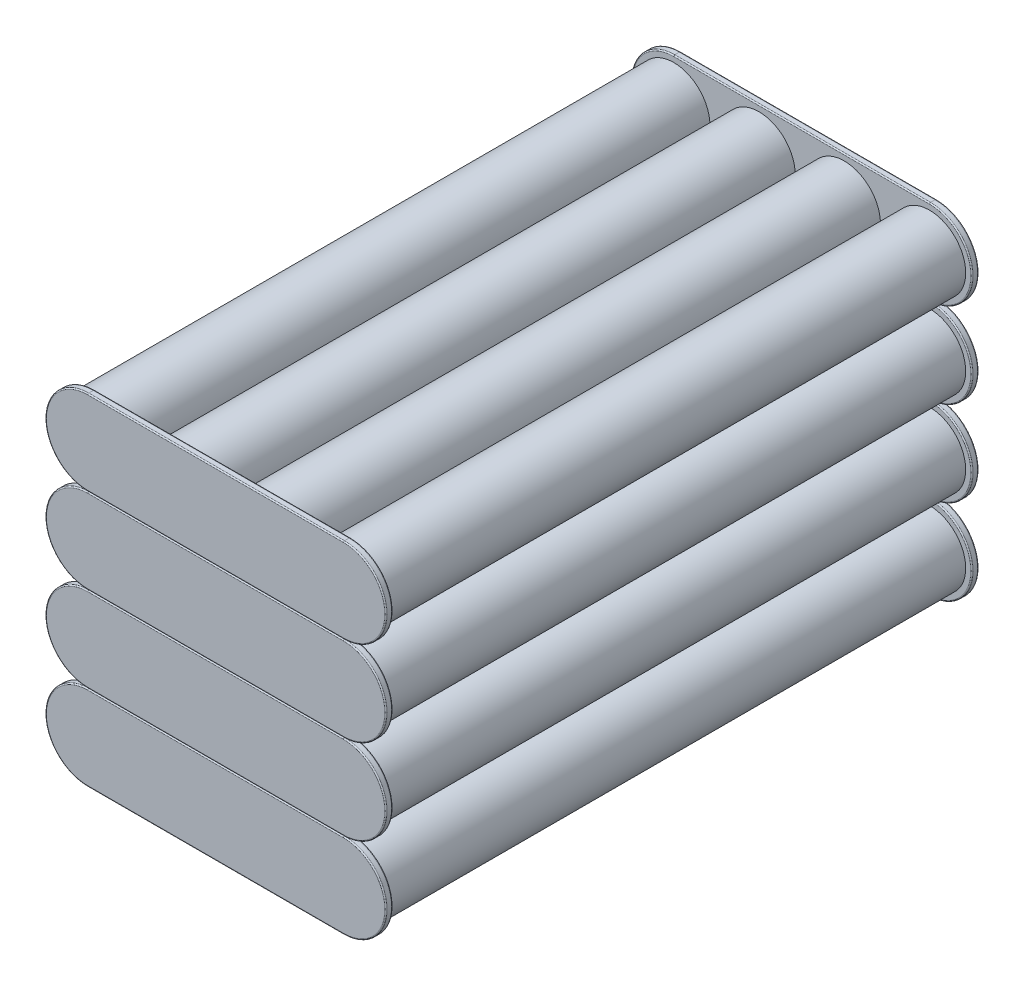
from build123d import *

# Parameters (mm, degrees)
SKETCH1_R              = 80.692435
BOSS_EXTRUDE1_DEPTH    = 1291.07896
BOSS_EXTRUDE1_2_DEPTH  = 1291.07896
BOSS_EXTRUDE1_3_DEPTH  = 1291.07896
BOSS_EXTRUDE1_4_DEPTH  = 1291.07896
BOSS_EXTRUDE1_5_DEPTH  = 1291.07896
BOSS_EXTRUDE1_6_DEPTH  = 1291.07896
BOSS_EXTRUDE1_7_DEPTH  = 1291.07896
BOSS_EXTRUDE1_8_DEPTH  = 1291.07896
BOSS_EXTRUDE1_9_DEPTH  = 1291.07896
BOSS_EXTRUDE1_10_DEPTH = 1291.07896
BOSS_EXTRUDE1_11_DEPTH = 1291.07896
BOSS_EXTRUDE1_12_DEPTH = 1291.07896
BOSS_EXTRUDE1_13_DEPTH = 1291.07896
BOSS_EXTRUDE1_14_DEPTH = 1291.07896
BOSS_EXTRUDE1_15_DEPTH = 1291.07896
BOSS_EXTRUDE1_16_DEPTH = 1291.07896
BOSS_EXTRUDE4_DEPTH    = 15
FILLET2_R              = 2.5
LPATTERN1_COUNT        = 4
LPATTERN1_PITCH        = 190
FILLET3_R              = 2.5
FILLET4_R              = 2.5
FILLET5_R              = 2.5
BOSS_EXTRUDE5_DEPTH    = 15
LPATTERN2_COUNT        = 4
LPATTERN2_PITCH        = 190
FILLET6_R              = 2.5
FILLET7_R              = 2.5
FILLET8_R              = 2.5
FILLET9_R              = 2.5


with BuildPart() as part:
    # Sketch1 → Boss-Extrude1 (new body)
    with BuildSketch(Plane.XY):
        with Locations((101.463857573, 0)):
            Circle(SKETCH1_R)
    extrude(amount=BOSS_EXTRUDE1_DEPTH)



with BuildPart() as body_2:
    # Sketch1 → Boss-Extrude1 2 (new body)
    with BuildSketch(Plane.XY):
        with Locations((291.463857573, 0)):
            Circle(SKETCH1_R)
    extrude(amount=BOSS_EXTRUDE1_2_DEPTH)


with BuildPart() as body_3:
    # Sketch1 → Boss-Extrude1 3 (new body)
    with BuildSketch(Plane.XY):
        with Locations((481.463857573, 0)):
            Circle(SKETCH1_R)
    extrude(amount=BOSS_EXTRUDE1_3_DEPTH)


with BuildPart() as body_4:
    # Sketch1 → Boss-Extrude1 4 (new body)
    with BuildSketch(Plane.XY):
        with Locations((671.463857573, 0)):
            Circle(SKETCH1_R)
    extrude(amount=BOSS_EXTRUDE1_4_DEPTH)


with BuildPart() as body_5:
    # Sketch1 → Boss-Extrude1 5 (new body)
    with BuildSketch(Plane.XY):
        with Locations((291.463857573, 190)):
            Circle(SKETCH1_R)
    extrude(amount=BOSS_EXTRUDE1_5_DEPTH)


with BuildPart() as body_6:
    # Sketch1 → Boss-Extrude1 6 (new body)
    with BuildSketch(Plane.XY):
        with Locations((481.463857573, 190)):
            Circle(SKETCH1_R)
    extrude(amount=BOSS_EXTRUDE1_6_DEPTH)


with BuildPart() as body_7:
    # Sketch1 → Boss-Extrude1 7 (new body)
    with BuildSketch(Plane.XY):
        with Locations((671.463857573, 190)):
            Circle(SKETCH1_R)
    extrude(amount=BOSS_EXTRUDE1_7_DEPTH)


with BuildPart() as body_8:
    # Sketch1 → Boss-Extrude1 8 (new body)
    with BuildSketch(Plane.XY):
        with Locations((291.463857573, 380)):
            Circle(SKETCH1_R)
    extrude(amount=BOSS_EXTRUDE1_8_DEPTH)


with BuildPart() as body_9:
    # Sketch1 → Boss-Extrude1 9 (new body)
    with BuildSketch(Plane.XY):
        with Locations((481.463857573, 380)):
            Circle(SKETCH1_R)
    extrude(amount=BOSS_EXTRUDE1_9_DEPTH)


with BuildPart() as body_10:
    # Sketch1 → Boss-Extrude1 10 (new body)
    with BuildSketch(Plane.XY):
        with Locations((671.463857573, 380)):
            Circle(SKETCH1_R)
    extrude(amount=BOSS_EXTRUDE1_10_DEPTH)


with BuildPart() as body_11:
    # Sketch1 → Boss-Extrude1 11 (new body)
    with BuildSketch(Plane.XY):
        with Locations((291.463857573, 570)):
            Circle(SKETCH1_R)
    extrude(amount=BOSS_EXTRUDE1_11_DEPTH)


with BuildPart() as body_12:
    # Sketch1 → Boss-Extrude1 12 (new body)
    with BuildSketch(Plane.XY):
        with Locations((481.463857573, 570)):
            Circle(SKETCH1_R)
    extrude(amount=BOSS_EXTRUDE1_12_DEPTH)


with BuildPart() as body_13:
    # Sketch1 → Boss-Extrude1 13 (new body)
    with BuildSketch(Plane.XY):
        with Locations((671.463857573, 570)):
            Circle(SKETCH1_R)
    extrude(amount=BOSS_EXTRUDE1_13_DEPTH)


with BuildPart() as body_14:
    # Sketch1 → Boss-Extrude1 14 (new body)
    with BuildSketch(Plane.XY):
        with Locations((101.463857573, 190)):
            Circle(SKETCH1_R)
    extrude(amount=BOSS_EXTRUDE1_14_DEPTH)


with BuildPart() as body_15:
    # Sketch1 → Boss-Extrude1 15 (new body)
    with BuildSketch(Plane.XY):
        with Locations((101.463857573, 380)):
            Circle(SKETCH1_R)
    extrude(amount=BOSS_EXTRUDE1_15_DEPTH)


with BuildPart() as body_16:
    # Sketch1 → Boss-Extrude1 16 (new body)
    with BuildSketch(Plane.XY):
        with Locations((101.463857573, 570)):
            Circle(SKETCH1_R)
    extrude(amount=BOSS_EXTRUDE1_16_DEPTH)


with BuildPart() as part_1:
    add(part.part)

    add(body_2.part)  # Boss-Extrude4 merges body 2

    add(body_3.part)  # Boss-Extrude4 merges body 3

    add(body_4.part)  # Boss-Extrude4 merges body 4
    # Sketch3 → Boss-Extrude4 (add)
    with BuildSketch(Plane.XY):
        with BuildLine():
            Line((101.463857573, 94.56136802), (671.463857573, 94.56136802))
            ThreePointArc((671.463857573, 94.56136802), (766.025225593, 0), (671.463857573, -94.56136802))
            Line((671.463857573, -94.56136802), (101.463857573, -94.56136802))
            ThreePointArc((101.463857573, -94.56136802), (6.902489553, 0), (101.463857573, 94.56136802))
        make_face()
    boss_extrude4 = extrude(amount=-BOSS_EXTRUDE4_DEPTH)

    # Fillet2
    fillet2_edges = [part_1.edges().sort_by_distance(p)[0] for p in [
        (386.463857573, -94.56136802, 0),
        (386.463857573, -94.56136802, -15),
        (766.025225593, 0, 0),
        (766.025225593, 0, -15),
        (6.902489553, 0, 0),
        (6.902489553, 0, -15),
        (386.463857573, 94.56136802, 0),
        (386.463857573, 94.56136802, -15),
    ]]
    fillet(fillet2_edges, radius=FILLET2_R)

    # Sketch7 → Boss-Extrude5 (add)
    with BuildSketch(Plane.XY.offset(1291.07896)):
        with BuildLine():
            Line((671.463857573, -94.56137), (101.463857573, -94.56137))
            ThreePointArc((101.463857573, -94.56137), (6.902487573, 0), (101.463857573, 94.56137))
            Line((101.463857573, 94.56137), (671.463857573, 94.56137))
            ThreePointArc((671.463857573, 94.56137), (766.025227573, 0), (671.463857573, -94.56137))
        make_face()
    boss_extrude5 = extrude(amount=BOSS_EXTRUDE5_DEPTH)

    # Fillet9
    fillet9_edges = [part_1.edges().sort_by_distance(p)[0] for p in [
        (6.902487573, 0, 1291.07896),
        (386.463857573, 94.56137, 1291.07896),
        (766.025227573, 0, 1291.07896),
        (6.902487573, 0, 1306.07896),
        (386.463857573, 94.56137, 1306.07896),
        (766.025227573, 0, 1306.07896),
        (386.463857573, -94.56137, 1291.07896),
        (386.463857573, -94.56137, 1306.07896),
    ]]
    fillet(fillet9_edges, radius=FILLET9_R)


with BuildPart() as body_5_1:
    add(body_5.part)

    add(body_6.part)  # LPattern1 merges body 6

    add(body_7.part)  # LPattern1 merges body 7

    add(body_8.part)  # LPattern1 merges body 8

    add(body_9.part)  # LPattern1 merges body 9

    add(body_10.part)  # LPattern1 merges body 10

    add(body_11.part)  # LPattern1 merges body 11

    add(body_12.part)  # LPattern1 merges body 12

    add(body_13.part)  # LPattern1 merges body 13

    add(body_14.part)  # LPattern1 merges body 14

    add(body_15.part)  # LPattern1 merges body 15

    add(body_16.part)  # LPattern1 merges body 16
    # LPattern1: Boss-Extrude4 ×4
    with Locations(*[(0, i * LPATTERN1_PITCH, 0) for i in range(1, LPATTERN1_COUNT)]):
        add(boss_extrude4)

    # Fillet3
    fillet3_edges = [body_5_1.edges().sort_by_distance(p)[0] for p in [
        (766.025225593, 190, 0),
        (386.463857573, 95.43863198, 0),
        (6.902489553, 190, 0),
        (766.025225593, 190, -15),
        (386.463857573, 95.43863198, -15),
        (6.902489553, 190, -15),
        (386.463857573, 284.56136802, 0),
        (386.463857573, 284.56136802, -15),
    ]]
    fillet(fillet3_edges, radius=FILLET3_R)

    # Fillet4
    fillet4_edges = [body_5_1.edges().sort_by_distance(p)[0] for p in [
        (766.025225593, 380, 0),
        (386.463857573, 285.43863198, 0),
        (6.902489553, 380, 0),
        (766.025225593, 380, -15),
        (386.463857573, 285.43863198, -15),
        (6.902489553, 380, -15),
        (386.463857573, 474.56136802, 0),
        (386.463857573, 474.56136802, -15),
    ]]
    fillet(fillet4_edges, radius=FILLET4_R)

    # Fillet5
    fillet5_edges = [body_5_1.edges().sort_by_distance(p)[0] for p in [
        (766.025225593, 570, 0),
        (386.463857573, 475.43863198, 0),
        (6.902489553, 570, 0),
        (766.025225593, 570, -15),
        (386.463857573, 475.43863198, -15),
        (6.902489553, 570, -15),
        (386.463857573, 664.56136802, 0),
        (386.463857573, 664.56136802, -15),
    ]]
    fillet(fillet5_edges, radius=FILLET5_R)

    # LPattern2: Boss-Extrude5 ×4
    with Locations(*[(0, i * LPATTERN2_PITCH, 0) for i in range(1, LPATTERN2_COUNT)]):
        add(boss_extrude5)

    # Fillet6
    fillet6_edges = [body_5_1.edges().sort_by_distance(p)[0] for p in [
        (766.025227573, 570, 1291.07896),
        (386.463857573, 475.43863, 1291.07896),
        (6.902487573, 570, 1291.07896),
        (766.025227573, 570, 1306.07896),
        (386.463857573, 475.43863, 1306.07896),
        (6.902487573, 570, 1306.07896),
        (386.463857573, 664.56137, 1291.07896),
        (386.463857573, 664.56137, 1306.07896),
    ]]
    fillet(fillet6_edges, radius=FILLET6_R)

    # Fillet7
    fillet7_edges = [body_5_1.edges().sort_by_distance(p)[0] for p in [
        (766.025227573, 380, 1306.07896),
        (386.463857573, 285.43863, 1306.07896),
        (6.902487573, 380, 1306.07896),
        (766.025227573, 380, 1291.07896),
        (386.463857573, 285.43863, 1291.07896),
        (6.902487573, 380, 1291.07896),
        (386.463857573, 474.56137, 1306.07896),
        (386.463857573, 474.56137, 1291.07896),
    ]]
    fillet(fillet7_edges, radius=FILLET7_R)

    # Fillet8
    fillet8_edges = [body_5_1.edges().sort_by_distance(p)[0] for p in [
        (766.025227573, 190, 1291.07896),
        (386.463857573, 95.43863, 1291.07896),
        (6.902487573, 190, 1291.07896),
        (766.025227573, 190, 1306.07896),
        (386.463857573, 95.43863, 1306.07896),
        (6.902487573, 190, 1306.07896),
        (386.463857573, 284.56137, 1291.07896),
        (386.463857573, 284.56137, 1306.07896),
    ]]
    fillet(fillet8_edges, radius=FILLET8_R)


solid = Compound([part_1.part, body_5_1.part])
